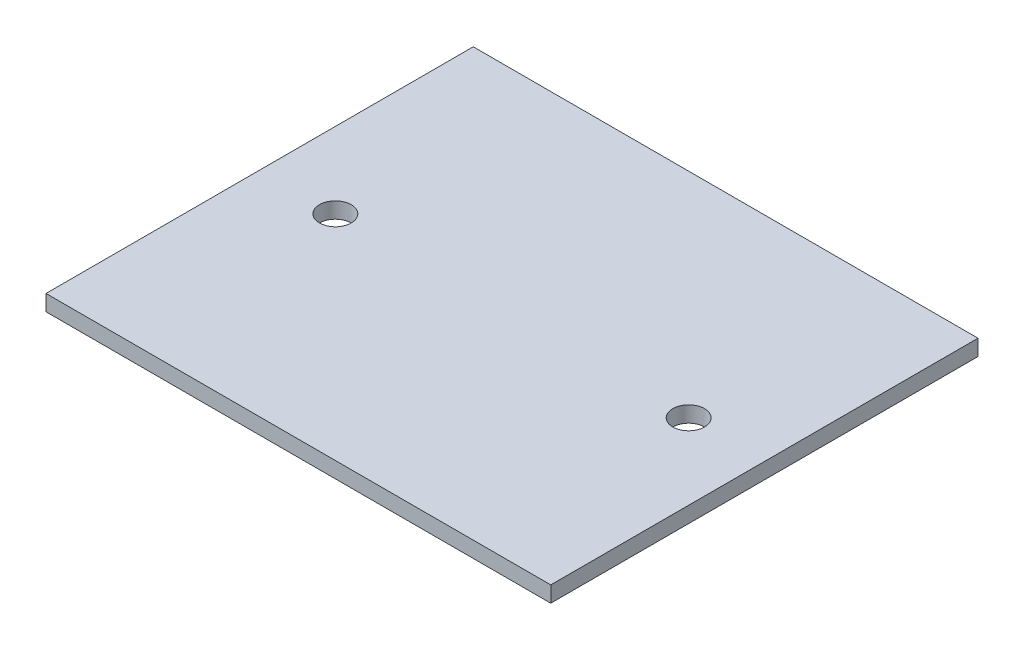
from build123d import *

# Parameters (mm, degrees)
SKETCH1_W           = 50.8
SKETCH1_H           = 43
SKETCH1_R           = 1.6
BOSS_EXTRUDE1_DEPTH = 1.6002


with BuildPart() as part:
    # Sketch1 → Boss-Extrude1 (new body)
    with BuildSketch(Plane(origin=(0, 0, 0), x_dir=(1, 0, 0), z_dir=(0, 1, 0))):
        with Locations((25.4, 21.5)):
            Rectangle(SKETCH1_W, SKETCH1_H)
        with Locations((7.62, 21.5)):
            Circle(SKETCH1_R, mode=Mode.SUBTRACT)
        with Locations((43.18, 21.5)):
            Circle(SKETCH1_R, mode=Mode.SUBTRACT)
    extrude(amount=BOSS_EXTRUDE1_DEPTH)


solid = part.part
